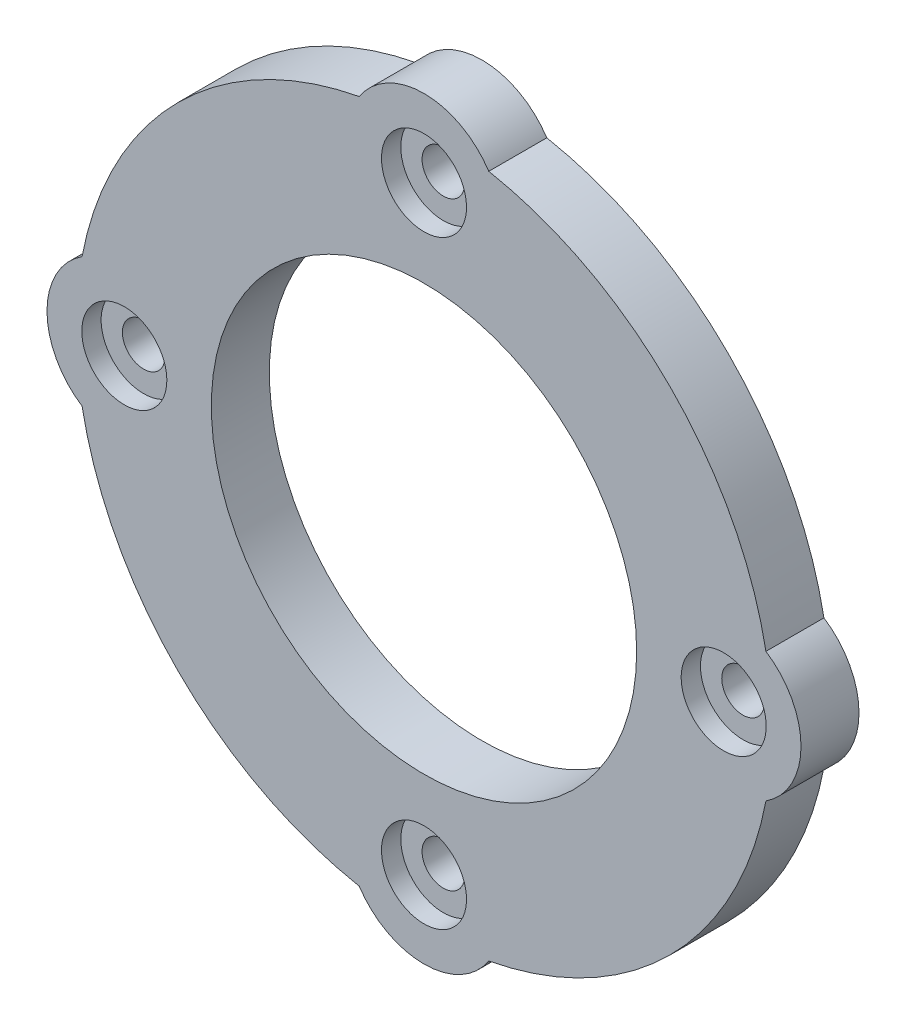
from build123d import *

# Parameters (mm, degrees)
EXTRUDE_1_DEPTH          = 3
SKETCH_2_R               = 11
CUT_EXTRUDE_1_DEPTH      = 28.739863013
SKETCH_3_R               = 2.2
CUT_EXTRUDE_2_DEPTH      = 1
SKETCH_4_R               = 1.1
CUT_EXTRUDE_3_DEPTH      = 28.649593125
PATTERN_CIRCULAR_1_COUNT = 4


with BuildPart() as part:
    # Эскиз1 → Бобышка-Вытянуть1 (new body)
    with BuildSketch(Plane.XY):
        with BuildLine():
            ThreePointArc((-17.685483871, -3.350173167), (-12.727922061, -12.727922061), (-3.350173167, -17.685483871))
            ThreePointArc((-3.350173167, -17.685483871), (0, -19.5), (3.350173167, -17.685483871))
            ThreePointArc((3.350173167, -17.685483871), (12.727922061, -12.727922061), (17.685483871, -3.350173167))
            ThreePointArc((17.685483871, -3.350173167), (19.5, 0), (17.685483871, 3.350173167))
            ThreePointArc((17.685483871, 3.350173167), (12.727922061, 12.727922061), (3.350173167, 17.685483871))
            ThreePointArc((3.350173167, 17.685483871), (0, 19.5), (-3.350173167, 17.685483871))
            ThreePointArc((-3.350173167, 17.685483871), (-12.727922061, 12.727922061), (-17.685483871, 3.350173167))
            ThreePointArc((-17.685483871, 3.350173167), (-19.5, 0), (-17.685483871, -3.350173167))
        make_face()
    extrude(amount=EXTRUDE_1_DEPTH)

    # Эскиз2 → Вырез-Вытянуть1 (cut, through all)
    with BuildSketch(Plane.XY.offset(3)):
        Circle(SKETCH_2_R)
    extrude(amount=-CUT_EXTRUDE_1_DEPTH, mode=Mode.SUBTRACT)

    # Эскиз3 → Вырез-Вытянуть2 (cut)
    with BuildSketch(Plane.XY.offset(3)):
        with Locations((-15.5, 0)):
            Circle(SKETCH_3_R)
    cut_extrude_2 = extrude(amount=-CUT_EXTRUDE_2_DEPTH, mode=Mode.SUBTRACT)

    # Эскиз4 → Вырез-Вытянуть3 (cut, through all)
    with BuildSketch(Plane.XY.offset(2)):
        with Locations((-15.5, 0)):
            Circle(SKETCH_4_R)
    cut_extrude_3 = extrude(amount=-CUT_EXTRUDE_3_DEPTH, mode=Mode.SUBTRACT)

    # Круговой массив1: Вырез-Вытянуть2, Вырез-Вытянуть3 ×4 about axis
    pattern_circular_1_axis = Axis((0, 0, 3), (0, 0, -1))
    add([cut_extrude_2.rotate(pattern_circular_1_axis, i * 360 / PATTERN_CIRCULAR_1_COUNT) for i in range(1, PATTERN_CIRCULAR_1_COUNT)], mode=Mode.SUBTRACT)
    add([cut_extrude_3.rotate(pattern_circular_1_axis, i * 360 / PATTERN_CIRCULAR_1_COUNT) for i in range(1, PATTERN_CIRCULAR_1_COUNT)], mode=Mode.SUBTRACT)


solid = part.part
